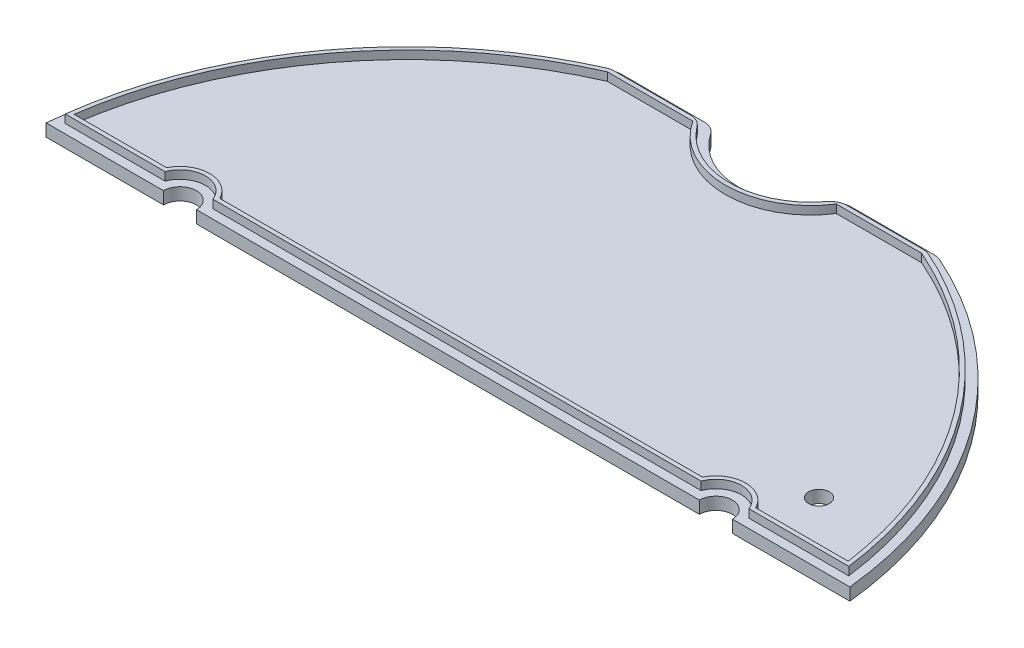
from build123d import *

# Parameters (mm, degrees)
SKETCH_1_R      = 2.5
EXTRUDE_1_DEPTH = 3
THICKEN_1_DEPTH = 2
FILLET_6_R      = 4


# Read off the part's stored shape, not the designer's step: 加厚1
with BuildPart() as part:
    # 草图1 → 凸台-拉伸1 (new body)
    with BuildSketch(Plane.XZ):
        with BuildLine():
            Line((-97.488460856, 0), (-69, 0))
            ThreePointArc((-69, 0), (-65, -4), (-61, 0))
            Line((-61, 0), (61, 0))
            ThreePointArc((61, 0), (65, -4), (69, 0))
            Line((69, 0), (97.488460856, 0))
            ThreePointArc((97.488460856, 0), (79.00867922, -47.979553361), (38.781438859, -80))
            Line((38.781438859, -80), (15.564382416, -80))
            ThreePointArc((15.564382416, -80), (0, -70.5), (-15.564382416, -80))
            Line((-15.564382416, -80), (-38.781438859, -80))
            ThreePointArc((-38.781438859, -80), (-79.00867922, -47.979553361), (-97.488460856, 0))
        make_face()
        with Locations(Location((75, -15, 0), (0, 0, 270))):
            Circle(SKETCH_1_R, mode=Mode.SUBTRACT)
    extrude(amount=EXTRUDE_1_DEPTH)

    # 加厚1 outline → 加厚1 (add)
    with BuildSketch(Plane(origin=(0, 0, 0), x_dir=(1, 0, 0), z_dir=(0, 1, 0))):
        with BuildLine():
            ThreePointArc((16.853782958, 77.8), (0, 68.3), (-16.853782958, 77.8))
            Line((-16.853782958, 77.8), (-38.324926614, 77.8))
            ThreePointArc((-38.324926614, 77.8), (-76.642398339, 47.476802076), (-95.019997895, 2.2))
            Line((-95.019997895, 2.2), (-70.796550698, 2.2))
            ThreePointArc((-70.796550698, 2.2), (-65, 6.2), (-59.203449302, 2.2))
            Line((-59.203449302, 2.2), (59.203449302, 2.2))
            ThreePointArc((59.203449302, 2.2), (65, 6.2), (70.796550698, 2.2))
            Line((70.796550698, 2.2), (95.019997895, 2.2))
            ThreePointArc((95.019997895, 2.2), (76.642398339, 47.476802076), (38.324926614, 77.8))
            Line((38.324926614, 77.8), (16.853782958, 77.8))
        make_face()
        with BuildLine():
            Line((-38.115613599, 76.8), (-17.408331339, 76.8))
            ThreePointArc((-17.408331339, 76.8), (0, 67.3), (17.408331339, 76.8))
            Line((17.408331339, 76.8), (38.115613599, 76.8))
            ThreePointArc((38.115613599, 76.8), (75.562692375, 47.247877874), (93.876514635, 3.2))
            Line((93.876514635, 3.2), (71.449806199, 3.2))
            ThreePointArc((71.449806199, 3.2), (65, 7.2), (58.550193801, 3.2))
            Line((58.550193801, 3.2), (-58.550193801, 3.2))
            ThreePointArc((-58.550193801, 3.2), (-65, 7.2), (-71.449806199, 3.2))
            Line((-71.449806199, 3.2), (-93.876514635, 3.2))
            ThreePointArc((-93.876514635, 3.2), (-75.562692375, 47.247877874), (-38.115613599, 76.8))
        make_face(mode=Mode.SUBTRACT)
    extrude(amount=THICKEN_1_DEPTH)

    # 圆角6
    fillet_6_edges = [part.edges().sort_by_distance(p)[0] for p in [
        (-38.781438859, -1.5, -80),
        (-15.564382416, -1.5, -80),
        (15.564382416, -1.5, -80),
        (38.781438859, -1.5, -80),
        (-38.324926614, 1, -77.8),
        (-16.853782958, 1, -77.8),
        (16.853782958, 1, -77.8),
    ]]
    fillet(fillet_6_edges, radius=FILLET_6_R)


solid = part.part
